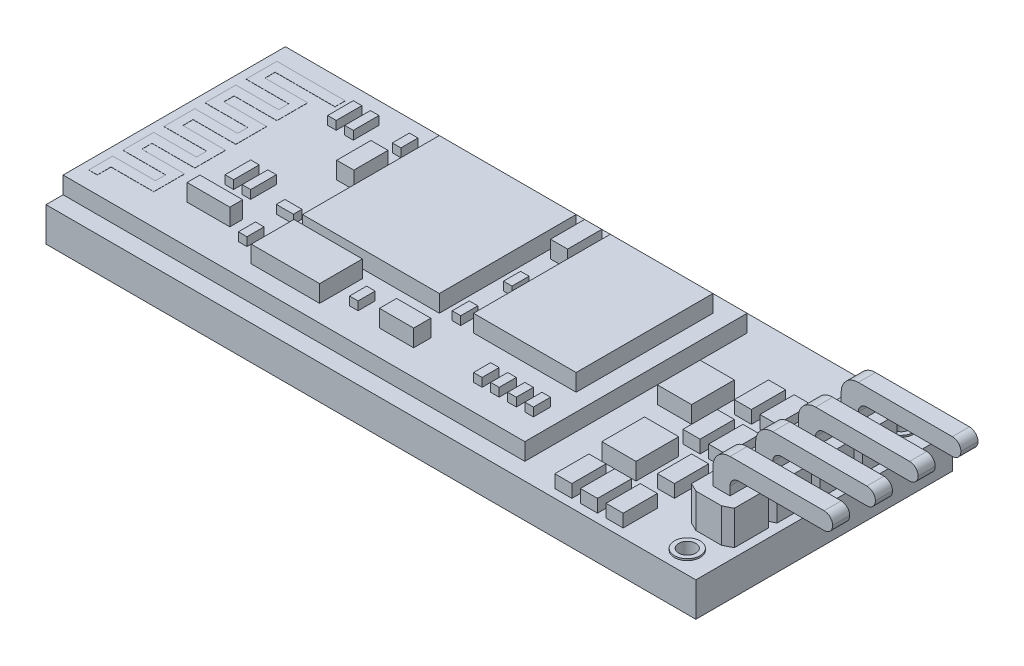
from build123d import *

# Parameters (mm, degrees)
CROQUIS1_W                    = 38
CROQUIS1_H                    = 15
SALIENTE_EXTRUIR1_DEPTH       = 2
CROQUIS2_W                    = 27
CROQUIS2_H                    = 13
SALIENTE_EXTRUIR2_DEPTH       = 1
SALIENTE_EXTRUIR3_DEPTH       = 2
CORTAR_EXTRUIR1_DEPTH         = 2
CROQUIS5_W                    = 1
CROQUIS5_H                    = 2
SALIENTE_EXTRUIR4_DEPTH       = 0.75
CROQUIS6_W                    = 2
CROQUIS6_H                    = 2.5
SALIENTE_EXTRUIR5_DEPTH       = 0.25
CROQUIS7_W                    = 2
CROQUIS7_H                    = 2.5
SALIENTE_EXTRUIR6_DEPTH       = 0.25
CROQUIS8_W                    = 1
CROQUIS8_H                    = 1
SALIENTE_EXTRUIR8_DEPTH       = 2
CROQUIS9_W                    = 1
CROQUIS9_H                    = 1
SALIENTE_EXTRUIR9_DEPTH       = 7
REDONDEO1_R                   = 0.5
REDONDEO2_R                   = 0.5
REDONDEO3_R                   = 0.5
REDONDEO4_R                   = 0.5
REDONDEO5_R                   = 1
REDONDEO6_R                   = 1
REDONDEO7_R                   = 1
REDONDEO8_R                   = 1
SALIENTE_EXTRUIR10_DEPTH      = 0.1
SALIENTE_EXTRUIR10_DEPTH_BACK = 2.1
CROQUIS10_R                   = 0.75
CROQUIS10_R_2                 = 0.5
CROQUIS11_R                   = 0.5
CORTAR_EXTRUIR2_DEPTH         = 2
CROQUIS12_R                   = 0.5
CORTAR_EXTRUIR3_DEPTH         = 2
CROQUIS13_W                   = 8
CROQUIS13_H                   = 8
CROQUIS13_W_2                 = 2
CROQUIS13_H_2                 = 1
SALIENTE_EXTRUIR11_DEPTH      = 1
SALIENTE_EXTRUIR12_DEPTH      = 0.01
CROQUIS15_W                   = 0.5
CROQUIS15_H                   = 1.5
CROQUIS15_W_2                 = 1
CROQUIS15_H_2                 = 0.5
CROQUIS15_W_3                 = 4
CROQUIS15_H_3                 = 2.5
CROQUIS15_H_4                 = 1
SALIENTE_EXTRUIR13_DEPTH      = 0.5
CROQUIS17_W                   = 2.5
CROQUIS17_H                   = 0.75
SALIENTE_EXTRUIR14_DEPTH      = 1
CROQUIS18_W                   = 1
CROQUIS18_H                   = 2
SALIENTE_EXTRUIR15_DEPTH      = 0.5
CROQUIS19_W                   = 4
CROQUIS19_H                   = 2.5
SALIENTE_EXTRUIR16_DEPTH      = 0.5
CROQUIS21_W                   = 1
CROQUIS21_H                   = 2
SALIENTE_EXTRUIR17_DEPTH      = 0.5
REDONDEO9_R                   = 0.5
REDONDEO12_R                  = 0.5
REDONDEO13_R                  = 0.5
REDONDEO14_R                  = 0.5
REDONDEO15_R                  = 0.5
REDONDEO16_R                  = 0.5
REDONDEO17_R                  = 0.5
REDONDEO18_R                  = 0.5


with BuildPart() as part:
    # Croquis1 → Saliente-Extruir1 (new body)
    with BuildSketch(Plane(origin=(0, 0, 0), x_dir=(1, 0, 0), z_dir=(0, 1, 0))):
        Rectangle(CROQUIS1_W, CROQUIS1_H)
    extrude(amount=SALIENTE_EXTRUIR1_DEPTH)

    # Croquis2 → Saliente-Extruir2 (add)
    with BuildSketch(Plane(origin=(0, 2, 0), x_dir=(1, 0, 0), z_dir=(0, 1, 0))):
        with Locations((-5.5, 0)):
            Rectangle(CROQUIS2_W, CROQUIS2_H)
    extrude(amount=SALIENTE_EXTRUIR2_DEPTH)

    # Croquis3 → Saliente-Extruir3 (add)
    with BuildSketch(Plane(origin=(0, 2, 0), x_dir=(1, 0, 0), z_dir=(0, 1, 0))):
        Polygon((16, -5), (18.5, -5), (18.5, 0), (18.5, 5), (16, 5), align=None)
    extrude(amount=SALIENTE_EXTRUIR3_DEPTH)

    # Croquis4 → Cortar-Extruir1 (cut)
    with BuildSketch(Plane(origin=(0, 4, 0), x_dir=(1, 0, 0), z_dir=(0, 1, 0))):
        Polygon((16, 5), (16, 4.75), (16.5, 5), align=None)
        Polygon((18, 5), (18.5, 4.75), (18.5, 5), align=None)
        Polygon((18, 2.5), (18.5, 2.25), (18.5, 2.75), align=None)
        Polygon((16, 2.75), (16, 2.25), (16.5, 2.5), align=None)
        Polygon((18, 0), (18.5, -0.25), (18.5, 0.25), align=None)
        Polygon((16, 0.25), (16, -0.25), (16.5, 0), align=None)
        Polygon((18, -2.5), (18.5, -2.75), (18.5, -2.25), align=None)
        Polygon((16, -2.25), (16, -2.75), (16.5, -2.5), align=None)
        Polygon((18.5, -4.75), (18, -5), (18.5, -5), align=None)
        Polygon((16, -4.75), (16, -5), (16.5, -5), align=None)
    extrude(amount=-CORTAR_EXTRUIR1_DEPTH, mode=Mode.SUBTRACT)

    # Croquis5 → Saliente-Extruir4 (add)
    with BuildSketch(Plane(origin=(0, 2, 0), x_dir=(1, 0, 0), z_dir=(0, 1, 0))):
        with Locations((13.75, -6)):
            Rectangle(CROQUIS5_W, CROQUIS5_H)
        Polygon((13.75, -4), (14.25, -4), (14.25, -2), (13.25, -2), (13.25, -4), align=None)
        Polygon((13.75, -1), (14.25, -1), (14.25, 1), (13.25, 1), (13.25, -1), align=None)
        Polygon((13.75, 2), (14.25, 2), (14.25, 4), (13.25, 4), (13.25, 2), align=None)
        Polygon((12.75, 4), (12.75, 2), (12.25, 2), (11.75, 2), (11.75, 4), align=None)
        Polygon((12.25, -1), (11.75, -1), (11.75, 1), (12.75, 1), (12.75, -1), align=None)
        with Locations((12.25, -6)):
            Rectangle(CROQUIS5_W, CROQUIS5_H)
        with Locations((10.75, -6)):
            Rectangle(CROQUIS5_W, CROQUIS5_H)
        Polygon((12.25, -3), (12.25, -4.25), (10.25, -4.25), (10.25, -1.75), (12.25, -1.75), align=None)
        Polygon((11, 1.5), (11, 0.25), (9, 0.25), (9, 2.75), (11, 2.75), align=None)
    extrude(amount=SALIENTE_EXTRUIR4_DEPTH)

    # Croquis6 → Saliente-Extruir5 (add)
    with BuildSketch(Plane(origin=(0, 2.75, 0), x_dir=(1, 0, 0), z_dir=(0, 1, 0))):
        with Locations((11.25, -3)):
            Rectangle(CROQUIS6_W, CROQUIS6_H)
    extrude(amount=SALIENTE_EXTRUIR5_DEPTH)

    # Croquis7 → Saliente-Extruir6 (add)
    with BuildSketch(Plane(origin=(0, 2.75, 0), x_dir=(1, 0, 0), z_dir=(0, 1, 0))):
        with Locations((10, 1.5)):
            Rectangle(CROQUIS7_W, CROQUIS7_H)
    extrude(amount=SALIENTE_EXTRUIR6_DEPTH)

    # Croquis8 → Saliente-Extruir8 (add)
    with BuildSketch(Plane(origin=(0, 4, 0), x_dir=(1, 0, 0), z_dir=(0, 1, 0))):
        with Locations((17.25, -3.75)):
            Rectangle(CROQUIS8_W, CROQUIS8_H)
        with Locations((17.25, -1.25)):
            Rectangle(CROQUIS8_W, CROQUIS8_H)
        with Locations((17.25, 1.25)):
            Rectangle(CROQUIS8_W, CROQUIS8_H)
        with Locations((17.25, 3.75)):
            Rectangle(CROQUIS8_W, CROQUIS8_H)
    extrude(amount=SALIENTE_EXTRUIR8_DEPTH)

    # Croquis9 → Saliente-Extruir9 (add)
    with BuildSketch(Plane.ZY.offset(-16.75)):
        with Locations((3.75, 5.5)):
            Rectangle(CROQUIS9_W, CROQUIS9_H)
        with Locations((1.25, 5.5)):
            Rectangle(CROQUIS9_W, CROQUIS9_H)
        with Locations((-1.25, 5.5)):
            Rectangle(CROQUIS9_W, CROQUIS9_H)
        with Locations((-3.75, 5.5)):
            Rectangle(CROQUIS9_W, CROQUIS9_H)
    extrude(amount=-SALIENTE_EXTRUIR9_DEPTH)

    # Redondeo1
    redondeo1_edges = [part.edges().sort_by_distance(p)[0] for p in [
        (17.75, 5, 3.75),
    ]]
    fillet(redondeo1_edges, radius=REDONDEO1_R)

    # Redondeo2
    redondeo2_edges = [part.edges().sort_by_distance(p)[0] for p in [
        (17.75, 5, 1.25),
    ]]
    fillet(redondeo2_edges, radius=REDONDEO2_R)

    # Redondeo3
    redondeo3_edges = [part.edges().sort_by_distance(p)[0] for p in [
        (17.75, 5, -1.25),
    ]]
    fillet(redondeo3_edges, radius=REDONDEO3_R)

    # Redondeo4
    redondeo4_edges = [part.edges().sort_by_distance(p)[0] for p in [
        (17.75, 5, -3.75),
    ]]
    fillet(redondeo4_edges, radius=REDONDEO4_R)

    # Redondeo5
    redondeo5_edges = [part.edges().sort_by_distance(p)[0] for p in [
        (16.75, 6, 3.75),
    ]]
    fillet(redondeo5_edges, radius=REDONDEO5_R)

    # Redondeo6
    redondeo6_edges = [part.edges().sort_by_distance(p)[0] for p in [
        (16.75, 6, 1.25),
    ]]
    fillet(redondeo6_edges, radius=REDONDEO6_R)

    # Redondeo7
    redondeo7_edges = [part.edges().sort_by_distance(p)[0] for p in [
        (16.75, 6, -1.25),
    ]]
    fillet(redondeo7_edges, radius=REDONDEO7_R)

    # Redondeo8
    redondeo8_edges = [part.edges().sort_by_distance(p)[0] for p in [
        (16.75, 6, -3.75),
    ]]
    fillet(redondeo8_edges, radius=REDONDEO8_R)

    # Croquis10 → Saliente-Extruir10 (add, two sides: drawn at the far end of the back side and taken through both)
    # profile 1 of 2: a face of its own
    with BuildSketch(Plane(origin=(0, 2, 0), x_dir=(1, 0, 0), z_dir=(0, 1, 0)).offset(-SALIENTE_EXTRUIR10_DEPTH_BACK)):
        with Locations(Location((17.25, -6.25, 0), (0, 0, 270))):
            Circle(CROQUIS10_R)
        with Locations(Location((17.25, -6.25, 0), (0, 0, 270))):
            Circle(CROQUIS10_R_2, mode=Mode.SUBTRACT)
    # profile 2 of 2: a face of its own
    with BuildSketch(Plane(origin=(0, 2, 0), x_dir=(1, 0, 0), z_dir=(0, 1, 0)).offset(-SALIENTE_EXTRUIR10_DEPTH_BACK)):
        with Locations(Location((17.25, 6.25, 0), (0, 0, 270))):
            Circle(CROQUIS10_R)
        with Locations(Location((17.25, 6.25, 0), (0, 0, 270))):
            Circle(CROQUIS10_R_2, mode=Mode.SUBTRACT)
    extrude(amount=SALIENTE_EXTRUIR10_DEPTH + SALIENTE_EXTRUIR10_DEPTH_BACK)

    # Croquis11 → Cortar-Extruir2 (cut)
    with BuildSketch(Plane(origin=(0, 2, 0), x_dir=(1, 0, 0), z_dir=(0, 1, 0))):
        with Locations(Location((17.25, 6.25, 0), (0, 0, 270))):
            Circle(CROQUIS11_R)
    extrude(amount=-CORTAR_EXTRUIR2_DEPTH, mode=Mode.SUBTRACT)

    # Croquis12 → Cortar-Extruir3 (cut)
    with BuildSketch(Plane(origin=(0, 2, 0), x_dir=(1, 0, 0), z_dir=(0, 1, 0))):
        with Locations(Location((17.25, -6.25, 0), (0, 0, 270))):
            Circle(CROQUIS12_R)
    extrude(amount=-CORTAR_EXTRUIR3_DEPTH, mode=Mode.SUBTRACT)

    # Croquis13 → Saliente-Extruir11 (add)
    with BuildSketch(Plane(origin=(0, 3, 0), x_dir=(1, 0, 0), z_dir=(0, 1, 0))):
        with Locations((-5, 1.5)):
            Rectangle(CROQUIS13_W, CROQUIS13_H)
        with Locations((-1, -4.5)):
            Rectangle(CROQUIS13_W_2, CROQUIS13_H_2)
        Polygon((1, 1.5), (1, 5.5), (7, 5.5), (7, -2.5), (1, -2.5), align=None)
    extrude(amount=SALIENTE_EXTRUIR11_DEPTH)

    # Croquis14 → Saliente-Extruir12 (add)
    with BuildSketch(Plane(origin=(0, 3, 0), x_dir=(1, 0, 0), z_dir=(0, 1, 0))):
        Polygon((-18.5, 5.5), (-14.5, 5.5), (-14.5, 4.9), (-18, 4.9), (-18, 4.3), (-15.5, 4.3), (-15.5, 2.5), (-18, 2.5), (-18, 1.9), (-15.5, 1.9), (-15.5, 0.1), (-18, 0.1), (-18, -0.5), (-15.5, -0.5), (-15.5, -2.3), (-18, -2.3), (-18, -2.9), (-15.5, -2.9), (-15.5, -4.7), (-18, -4.7), (-18, -5.5), (-18.5, -5.5), (-18.5, -4.1), (-16, -4.1), (-16, -3.5), (-18.5, -3.5), (-18.5, -1.7), (-16, -1.7), (-16, -1.1), (-18.5, -1.1), (-18.5, 0.7), (-16, 0.7), (-16, 1.3), (-18.5, 1.3), (-18.5, 3.1), (-16, 3.1), (-16, 3.7), (-18.5, 3.7), align=None)
    extrude(amount=SALIENTE_EXTRUIR12_DEPTH)

    # Croquis15 → Saliente-Extruir13 (add)
    with BuildSketch(Plane(origin=(0, 3, 0), x_dir=(1, 0, 0), z_dir=(0, 1, 0))):
        with Locations((-12.530313676, -1.5)):
            Rectangle(CROQUIS15_W, CROQUIS15_H)
        with Locations((-10.280313676, -2)):
            Rectangle(CROQUIS15_W_2, CROQUIS15_H_2)
        Polygon((-10.75, 3.25), (-10.25, 3.25), (-9.75, 3.25), (-9.75, 1.25), (-10.75, 1.25), align=None)
        with Locations((-7, -4.25)):
            Rectangle(CROQUIS15_W_3, CROQUIS15_H_3)
        with Locations((-3.75, -4.25)):
            Rectangle(CROQUIS15_W, CROQUIS15_H_4)
        with Locations((0, -2)):
            Rectangle(CROQUIS15_W, CROQUIS15_H_4)
        with Locations((0, 1)):
            Rectangle(CROQUIS15_W, CROQUIS15_H_4)
        Polygon((-0.5, 5.5), (-0.5, 3.5), (0, 3.5), (0.5, 3.5), (0.5, 5.5), align=None)
        with Locations((3.75, -4.5)):
            Rectangle(CROQUIS15_W, CROQUIS15_H_4)
        with Locations((4.75, -4.5)):
            Rectangle(CROQUIS15_W, CROQUIS15_H_4)
        with Locations((5.75, -4.5)):
            Rectangle(CROQUIS15_W, CROQUIS15_H_4)
        with Locations((6.75, -4.5)):
            Rectangle(CROQUIS15_W, CROQUIS15_H_4)
        with Locations((-13.530313676, 4.5)):
            Rectangle(CROQUIS15_W, CROQUIS15_H)
        with Locations((-12.530313676, 4.5)):
            Rectangle(CROQUIS15_W, CROQUIS15_H)
        with Locations((-10.25, 4.75)):
            Rectangle(CROQUIS15_W, CROQUIS15_H_4)
        with Locations((-13.530313676, -1.5)):
            Rectangle(CROQUIS15_W, CROQUIS15_H)
        with Locations((-10.25, -4.25)):
            Rectangle(CROQUIS15_W, CROQUIS15_H_4)
    extrude(amount=SALIENTE_EXTRUIR13_DEPTH)

    # Croquis17 → Saliente-Extruir14 (add)
    with BuildSketch(Plane(origin=(0, 3, 0), x_dir=(1, 0, 0), z_dir=(0, 1, 0))):
        with Locations((-12.75, -3.875)):
            Rectangle(CROQUIS17_W, CROQUIS17_H)
    extrude(amount=SALIENTE_EXTRUIR14_DEPTH)

    # Croquis18 → Saliente-Extruir15 (add)
    with BuildSketch(Plane(origin=(0, 3.5, 0), x_dir=(1, 0, 0), z_dir=(0, 1, 0))):
        with Locations((-10.25, 2.25)):
            Rectangle(CROQUIS18_W, CROQUIS18_H)
    extrude(amount=SALIENTE_EXTRUIR15_DEPTH)

    # Croquis19 → Saliente-Extruir16 (add)
    with BuildSketch(Plane(origin=(0, 3.5, 0), x_dir=(1, 0, 0), z_dir=(0, 1, 0))):
        with Locations((-7, -4.25)):
            Rectangle(CROQUIS19_W, CROQUIS19_H)
    extrude(amount=SALIENTE_EXTRUIR16_DEPTH)

    # Croquis21 → Saliente-Extruir17 (add)
    with BuildSketch(Plane(origin=(0, 3.5, 0), x_dir=(1, 0, 0), z_dir=(0, 1, 0))):
        with Locations((0, 4.5)):
            Rectangle(CROQUIS21_W, CROQUIS21_H)
    extrude(amount=SALIENTE_EXTRUIR17_DEPTH)

    # Redondeo9
    redondeo9_edges = [part.edges().sort_by_distance(p)[0] for p in [
        (23.75, 6, 3.75),
    ]]
    fillet(redondeo9_edges, radius=REDONDEO9_R)

    # Redondeo12
    redondeo12_edges = [part.edges().sort_by_distance(p)[0] for p in [
        (23.75, 5, 3.75),
    ]]
    fillet(redondeo12_edges, radius=REDONDEO12_R - 0.0001)  # a hair under: the kernel refuses the full size

    # Redondeo13
    redondeo13_edges = [part.edges().sort_by_distance(p)[0] for p in [
        (23.75, 6, 1.25),
    ]]
    fillet(redondeo13_edges, radius=REDONDEO13_R)

    # Redondeo14
    redondeo14_edges = [part.edges().sort_by_distance(p)[0] for p in [
        (23.75, 5, 1.25),
    ]]
    fillet(redondeo14_edges, radius=REDONDEO14_R - 0.0001)  # a hair under: the kernel refuses the full size

    # Redondeo15
    redondeo15_edges = [part.edges().sort_by_distance(p)[0] for p in [
        (23.75, 6, -1.25),
    ]]
    fillet(redondeo15_edges, radius=REDONDEO15_R)

    # Redondeo16
    redondeo16_edges = [part.edges().sort_by_distance(p)[0] for p in [
        (23.75, 5, -1.25),
    ]]
    fillet(redondeo16_edges, radius=REDONDEO16_R - 0.0001)  # a hair under: the kernel refuses the full size

    # Redondeo17
    redondeo17_edges = [part.edges().sort_by_distance(p)[0] for p in [
        (23.75, 6, -3.75),
    ]]
    fillet(redondeo17_edges, radius=REDONDEO17_R)

    # Redondeo18
    redondeo18_edges = [part.edges().sort_by_distance(p)[0] for p in [
        (23.75, 5, -3.75),
    ]]
    fillet(redondeo18_edges, radius=REDONDEO18_R - 0.0001)  # a hair under: the kernel refuses the full size


solid = part.part
